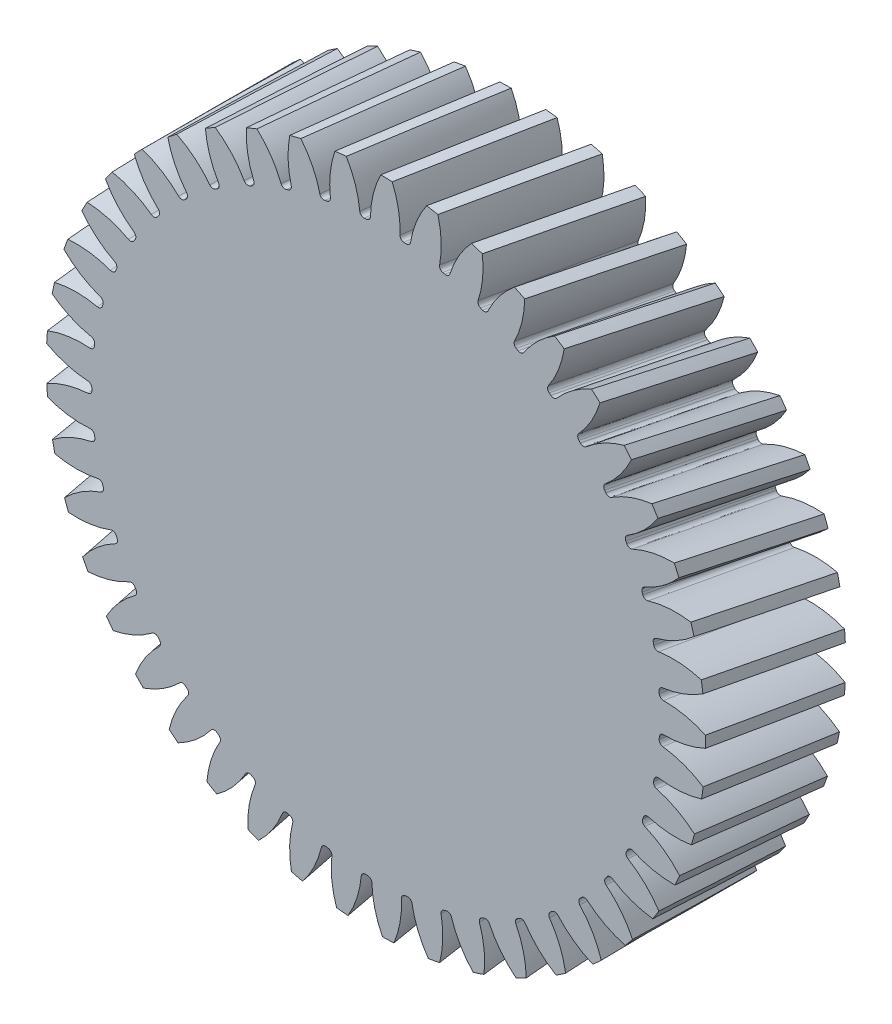
from build123d import *

# Parameters (mm, degrees)
SKETCH1_R                = 35.25
BOSS_EXTRUDE1_DEPTH      = 7.5
FILLET1_R                = 0.45
CIRPATTERN1_COUNT        = 45
FILLET1_OF_CIRPATTERN1_R = 0.45


with BuildPart() as part:
    # Sketch1 → Boss-Extrude1 (new, symmetric)
    with BuildSketch(Plane.XY):
        Circle(SKETCH1_R)
    extrude(amount=BOSS_EXTRUDE1_DEPTH, both=True)

    # Sketch8 for Cut-Loft1 → Cut-Loft1 section 0
    with BuildSketch(Plane(origin=(0, 0, 7.5), x_dir=(0.9992960128591387, 0.037516378874141346, 0), z_dir=(0, 0, 1))):
        with BuildLine():
            # circular arc as an exact rational Bezier (weights 1, cos(half-angle), 1)
            Bezier((-2.453099767, 36.166902017), (-0.612040775, 33.560485811), (-0.553855147, 30.369950107), weights=[1, 0.95581627, 1])
            Bezier((-0.553855147, 30.369950107), (0, 30.380050733), (0.553855147, 30.369950107), weights=[1, 0.999833748, 1])
            Bezier((0.553855147, 30.369950107), (0.612040775, 33.560485811), (2.453099767, 36.166902017), weights=[1, 0.95581627, 1])
            Bezier((2.453099767, 36.166902017), (0, 36.333288911), (-2.453099767, 36.166902017), weights=[1, 0.997707642, 1])
        make_face()
    # Sketch2 for Cut-Loft1 → Cut-Loft1 section 1
    with BuildSketch(Plane.XY):
        with BuildLine():
            Bezier((-2.453099767, 36.166902017), (-0.612040775, 33.560485811), (-0.553855147, 30.369950107), weights=[1, 0.95581627, 1])
            Bezier((-0.553855147, 30.369950107), (0, 30.380050733), (0.553855147, 30.369950107), weights=[1, 0.999833748, 1])
            Bezier((0.553855147, 30.369950107), (0.612040775, 33.560485811), (2.453099767, 36.166902017), weights=[1, 0.95581627, 1])
            Bezier((2.453099767, 36.166902017), (0, 36.333288911), (-2.453099767, 36.166902017), weights=[1, 0.997707642, 1])
        make_face()
    # Sketch9 for Cut-Loft1 → Cut-Loft1 section 2
    with BuildSketch(Plane(origin=(0, 0, -7.5), x_dir=(0.9992960128591387, -0.0375163788741417, 0), z_dir=(0, 0, 1))):
        with BuildLine():
            Bezier((-2.453099767, 36.166902017), (-0.612040775, 33.560485811), (-0.553855147, 30.369950107), weights=[1, 0.95581627, 1])
            Bezier((-0.553855147, 30.369950107), (0, 30.380050733), (0.553855147, 30.369950107), weights=[1, 0.999833748, 1])
            Bezier((0.553855147, 30.369950107), (0.612040775, 33.560485811), (2.453099767, 36.166902017), weights=[1, 0.95581627, 1])
            Bezier((2.453099767, 36.166902017), (0, 36.333288911), (-2.453099767, 36.166902017), weights=[1, 0.997707642, 1])
        make_face()
    cut_loft1 = loft(mode=Mode.SUBTRACT)

    # Fillet1
    fillet1_edges = [part.edges().sort_by_distance(p)[0] for p in [
        (0.553855147, 30.369950107, 0),
        (-0.553855147, 30.369950107, 0),
    ]]
    fillet(fillet1_edges, radius=FILLET1_R)

    # CirPattern1: Cut-Loft1 ×45 about axis
    cirpattern1_axis = Axis((0, 0, 7.5), (0, 0, 1))
    for i in range(1, CIRPATTERN1_COUNT):
        add(cut_loft1.rotate(cirpattern1_axis, i * 360 / CIRPATTERN1_COUNT), mode=Mode.SUBTRACT)

    # Fillet1 of CirPattern1
    fillet1_of_cirpattern1_edges = [part.edges().sort_by_distance(p)[0] for p in [
        (-3.678215065, 30.151473578, 0),
        (-4.775145199, 29.997310102, 0),
        (-7.838693006, 29.346132913, 0),
        (-8.903492482, 29.040806577, 0),
        (-11.846599703, 27.969603152, 0),
        (-12.858543411, 27.519056785, 0),
        (-15.623925812, 26.04867688, 0),
        (-16.563317418, 25.461679856, 0),
        (-19.097149978, 23.620742743, 0),
        (-19.945705293, 22.908720291, 0),
        (-22.198669841, 20.733057717, 0),
        (-22.939872702, 19.909868543, 0),
        (-24.868117847, 17.441827305, 0),
        (-25.487541583, 16.523493852, 0),
        (-27.053536226, 13.811111565, 0),
        (-27.539124458, 12.815508147, 0),
        (-28.712388296, 9.911578248, 0),
        (-29.054689601, 8.858083154, 0),
        (-29.812386387, 5.819127335, 0),
        (-30.004738261, 4.728245649, 0),
        (-30.332120288, 1.613413727, 0),
        (-30.370778819, 0.50637822, 0),
        (-30.26147397, -2.623703143, 0),
        (-30.145686715, -3.725345285, 0),
        (-29.601822483, -6.809752617, 0),
        (-29.333843109, -7.884559181, 0),
        (-28.366005193, -10.863258001, 0),
        (-27.951049613, -11.890309102, 0),
        (-26.578075878, -14.705322426, 0),
        (-26.02422073, -15.664627681, 0),
        (-24.272834548, -18.261164476, 0),
        (-23.590859993, -19.1340521, 0),
        (-21.495150103, -21.461573732, 0),
        (-20.698330001, -22.23105396, 0),
        (-18.299087012, -24.244257867, 0),
        (-17.402930559, -24.895353642, 0),
        (-14.746853007, -26.5550551, 0),
        (-13.768802869, -27.075093583, 0),
        (-10.907588283, -28.348988392, 0),
        (-9.866681093, -28.727847626, 0),
        (-6.85601976, -29.591140871, 0),
        (-5.772515593, -29.821446791, 0),
        (-2.671006611, -30.257335452, 0),
        (-1.565994643, -30.334605417, 0),
        (1.565994643, -30.334605417, 0),
        (2.671006611, -30.257335452, 0),
        (5.772515593, -29.821446791, 0),
        (6.85601976, -29.591140871, 0),
        (9.866681093, -28.727847626, 0),
        (10.907588283, -28.348988392, 0),
        (13.768802869, -27.075093583, 0),
        (14.746853007, -26.5550551, 0),
        (17.402930559, -24.895353642, 0),
        (18.299087012, -24.244257867, 0),
        (20.698330001, -22.23105396, 0),
        (21.495150103, -21.461573732, 0),
        (23.590859993, -19.1340521, 0),
        (24.272834548, -18.261164476, 0),
        (26.02422073, -15.664627681, 0),
        (26.578075878, -14.705322426, 0),
        (27.951049613, -11.890309102, 0),
        (28.366005193, -10.863258001, 0),
        (29.333843109, -7.884559181, 0),
        (29.601822483, -6.809752617, 0),
        (30.145686715, -3.725345285, 0),
        (30.26147397, -2.623703143, 0),
        (30.370778819, 0.50637822, 0),
        (30.332120288, 1.613413727, 0),
        (30.004738261, 4.728245649, 0),
        (29.812386387, 5.819127335, 0),
        (29.054689601, 8.858083154, 0),
        (28.712388296, 9.911578248, 0),
        (27.539124458, 12.815508147, 0),
        (27.053536226, 13.811111565, 0),
        (25.487541583, 16.523493852, 0),
        (24.868117847, 17.441827305, 0),
        (22.939872702, 19.909868543, 0),
        (22.198669841, 20.733057717, 0),
        (19.945705293, 22.908720291, 0),
        (19.097149978, 23.620742743, 0),
        (16.563317418, 25.461679856, 0),
        (15.623925812, 26.04867688, 0),
        (12.858543411, 27.519056785, 0),
        (11.846599703, 27.969603152, 0),
        (8.903492482, 29.040806577, 0),
        (7.838693006, 29.346132913, 0),
        (4.775145199, 29.997310102, 0),
        (3.678215065, 30.151473578, 0),
    ]]
    fillet(fillet1_of_cirpattern1_edges, radius=FILLET1_OF_CIRPATTERN1_R)


solid = part.part
